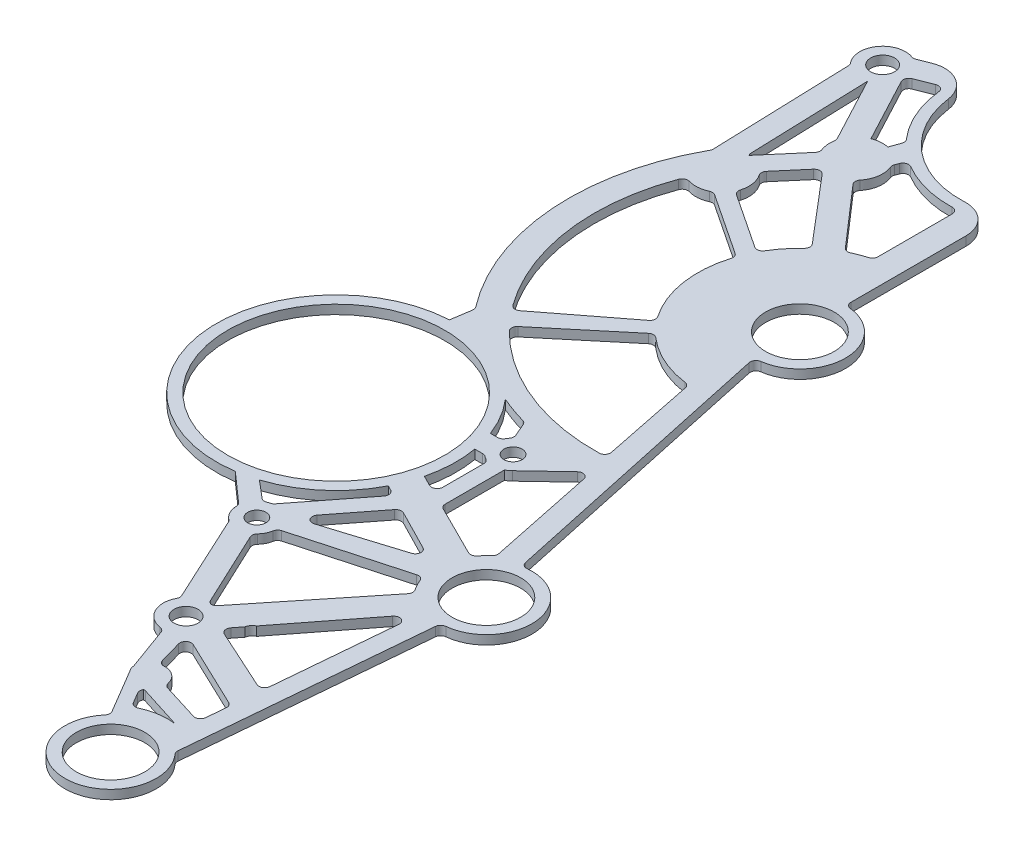
from build123d import *

# Parameters (mm, degrees)
SKETCH1_R           = 1.6
SKETCH1_R_2         = 2
SKETCH1_R_3         = 1.65
SKETCH1_R_4         = 6
BOSS_EXTRUDE2_DEPTH = 1.5875
BOSS_EXTRUDE3_START = -1.5875
BOSS_EXTRUDE3_DEPTH = 1.5875
SKETCH4_R           = 4.4
SKETCH4_R_2         = 2.1
CUT_EXTRUDE1_DEPTH  = 1.5875
BOSS_EXTRUDE4_START = -1.5875
BOSS_EXTRUDE4_DEPTH = 1.5875
SKETCH7_R           = 2.1
CUT_EXTRUDE2_DEPTH  = 1.5875
CUT_EXTRUDE3_DEPTH  = 1.5875
CUT_EXTRUDE4_DEPTH  = 1.5875
SKETCH10_R          = 4.645349595
BOSS_EXTRUDE5_DEPTH = 1.5875
CUT_EXTRUDE5_DEPTH  = 1.5875
CUT_EXTRUDE9_DEPTH  = 1.5875
SKETCH19_R          = 4
BOSS_EXTRUDE8_DEPTH = 1.5875
SKETCH20_R          = 2.1
CUT_EXTRUDE12_DEPTH = 1.5875
FILLET1_START       = -1
FILLET1_DEPTH       = 4
FILLET1_2_DEPTH     = 1.5875
SKETCH21_R          = 21
BOSS_EXTRUDE9_DEPTH = 1.5875
SKETCH22_R          = 19
SKETCH22_R_2        = 16.40193841
CUT_EXTRUDE13_DEPTH = 1.5875
FILLET2_R           = 5


with BuildPart() as part:
    # Sketch1 → Boss-Extrude2 (new body)
    with BuildSketch(Plane(origin=(0, 0, 0), x_dir=(1, 0, 0), z_dir=(0, 1, 0))):
        with BuildLine():
            Line((57.785577921, -3.804263015), (46.607089569, 48.169037391))
            ThreePointArc((46.607089569, 48.169037391), (54.607089569, 56.169037391), (46.607089569, 64.169037391))
            Line((46.607089569, 64.169037391), (46.607089569, 96.669037391))
            ThreePointArc((46.607089569, 96.669037391), (9.774896481, 73.010639225), (15.974342375, 29.675928865))
            Line((15.974342375, 29.675928865), (13.412399058, 22.705365919))
            ThreePointArc((13.412399058, 22.705365919), (-1.253243965, 6.307648563), (13.412399058, -10.090068793))
            Line((13.412399058, -10.090068793), (44.33382846, -62.316035804))
            ThreePointArc((44.33382846, -62.316035804), (50, -75.963557391), (55.66617154, -62.316035804))
            Line((55.66617154, -62.316035804), (59.462816555, -19.578912916))
            ThreePointArc((59.462816555, -19.578912916), (67.394599283, -10.759075533), (57.785577921, -3.804263015))
        make_face()
        with Locations(Location((27.233234802, -19.578912916, 0), (0, 0, 270))):
            Circle(SKETCH1_R, mode=Mode.SUBTRACT)
        with Locations(Location((44.33382846, -37.488387538, 0), (0, 0, 270))):
            Circle(SKETCH1_R, mode=Mode.SUBTRACT)
        with Locations(Location((40.089632361, 12.439739227, 0), (0, 0, 270))):
            Circle(SKETCH1_R, mode=Mode.SUBTRACT)
        with Locations(Location((12.005418324, 17.147101033, 0), (0, 0, 270))):
            Circle(SKETCH1_R_2, mode=Mode.SUBTRACT)
        with Locations(Location((26.086208505, 9.548986275, 0), (0, 0, 270))):
            Circle(SKETCH1_R_3, mode=Mode.SUBTRACT)
        with Locations(Location((4.407303566, 3.066310852, 0), (0, 0, 270))):
            Circle(SKETCH1_R_2, mode=Mode.SUBTRACT)
        with Locations(Location((18.488093747, -4.531803906, 0), (0, 0, 270))):
            Circle(SKETCH1_R_3, mode=Mode.SUBTRACT)
        with Locations(Location((46.607089569, 56.169037391, 0), (0, 0, 270))):
            Circle(SKETCH1_R_4, mode=Mode.SUBTRACT)
        with Locations(Location((59.462816555, -11.60242182, 0), (0, 0, 270))):
            Circle(SKETCH1_R_4, mode=Mode.SUBTRACT)
        with Locations(Location((50, -67.963557391, 0), (0, 0, 270))):
            Circle(SKETCH1_R_4, mode=Mode.SUBTRACT)
    extrude(amount=BOSS_EXTRUDE2_DEPTH)

    # Sketch3 → Boss-Extrude3 (add)
    with BuildSketch(Plane(origin=(0, 1.5875, 0), x_dir=(1, 0, 0), z_dir=(0, 1, 0)).offset(BOSS_EXTRUDE3_START)):
        with BuildLine():
            ThreePointArc((56.343437375, 106.672616503), (38.029280092, 122.267991205), (25.551142047, 101.702968958))
            ThreePointArc((25.551142047, 101.702968958), (27.87263843, 97.242332074), (31.478334129, 93.737252132))
            ThreePointArc((31.478334129, 93.737252132), (38.901984022, 95.929336038), (46.607089569, 96.669037391))
            Line((46.607089569, 96.669037391), (46.607089569, 92.08436081))
            ThreePointArc((46.607089569, 92.08436081), (53.685796044, 97.903157102), (56.343437375, 106.672616503))
        make_face()
        with BuildLine():
            ThreePointArc((46.607089569, 96.669037391), (38.901984022, 95.929336038), (31.478334129, 93.737252132))
            ThreePointArc((31.478334129, 93.737252132), (38.83054718, 90.968883646), (46.607089569, 92.08436081))
            Line((46.607089569, 92.08436081), (46.607089569, 96.669037391))
        make_face()
        with BuildLine():
            Line((25.551142047, 101.702968958), (23.684957519, 89.558045497))
            ThreePointArc((23.684957519, 89.558045497), (27.467237121, 91.860997946), (31.478334129, 93.737252132))
            ThreePointArc((31.478334129, 93.737252132), (27.87263843, 97.242332074), (25.551142047, 101.702968958))
        make_face()
        with BuildLine():
            Line((14.718034312, 31.202296417), (13.412399058, 22.705365919))
            Line((13.412399058, 22.705365919), (15.974342375, 29.675928865))
            ThreePointArc((15.974342375, 29.675928865), (15.33687379, 30.431446107), (14.718034312, 31.202296417))
        make_face()
    extrude(amount=BOSS_EXTRUDE3_DEPTH)

    # Sketch4 → Cut-Extrude1 (cut)
    with BuildSketch(Plane(origin=(0, 1.5875, 0), x_dir=(1, 0, 0), z_dir=(0, 1, 0))):
        with Locations(Location((40.546257627, 106.672616503, 0), (0, 0, 270))):
            Circle(SKETCH4_R)
        with Locations(Location((40.546257627, 117.14024961, 0), (0, 0, 270))):
            Circle(SKETCH4_R_2)
        with Locations(Location((30.07862452, 106.672616503, 0), (0, 0, 270))):
            Circle(SKETCH4_R_2)
        with Locations(Location((51.013890734, 106.672616503, 0), (0, 0, 270))):
            Circle(SKETCH4_R_2)
        with Locations(Location((40.546257627, 96.204983396, 0), (0, 0, 270))):
            Circle(SKETCH4_R_2)
    extrude(amount=-CUT_EXTRUDE1_DEPTH, mode=Mode.SUBTRACT)

    # Sketch5 → Boss-Extrude4 (add)
    with BuildSketch(Plane(origin=(0, 1.5875, 0), x_dir=(1, 0, 0), z_dir=(0, 1, 0)).offset(BOSS_EXTRUDE4_START)):
        with BuildLine():
            ThreePointArc((25.551142047, 101.702968958), (24.749079693, 106.66504565), (25.546385494, 111.627888844))
            Line((25.546385494, 111.627888844), (15.069905078, 107.519355049))
            ThreePointArc((15.069905078, 107.519355049), (16.746586116, 106.043341376), (17.370320575, 103.898386599))
            ThreePointArc((17.370320575, 103.898386599), (14.869777486, 100.190067711), (10.494506089, 101.118154407))
            Line((10.494506089, 101.118154407), (11.324057448, 76.05263979))
            ThreePointArc((11.324057448, 76.05263979), (16.731358953, 83.512971273), (23.684957519, 89.558045497))
            Line((23.684957519, 89.558045497), (25.551142047, 101.702968958))
        make_face()
        with BuildLine():
            ThreePointArc((17.370320575, 103.898386599), (16.746586116, 106.043341376), (15.069905078, 107.519355049))
            Line((15.069905078, 107.519355049), (10.494506089, 101.118154407))
            ThreePointArc((10.494506089, 101.118154407), (14.869777486, 100.190067711), (17.370320575, 103.898386599))
        make_face()
        with BuildLine():
            Line((10.494506089, 101.118154407), (15.069905078, 107.519355049))
            ThreePointArc((15.069905078, 107.519355049), (10.116135322, 106.224387102), (10.494506089, 101.118154407))
        make_face()
    extrude(amount=BOSS_EXTRUDE4_DEPTH)

    # Sketch7 → Cut-Extrude2 (cut)
    with BuildSketch(Plane(origin=(0, 1.5875, 0), x_dir=(1, 0, 0), z_dir=(0, 1, 0))):
        with Locations(Location((13.370320575, 103.898386599, 0), (0, 0, 270))):
            Circle(SKETCH7_R)
    extrude(amount=-CUT_EXTRUDE2_DEPTH, mode=Mode.SUBTRACT)

    # Sketch8 → Cut-Extrude3 (cut)
    with BuildSketch(Plane(origin=(0, 1.5875, 0), x_dir=(1, 0, 0), z_dir=(0, 1, 0))):
        with BuildLine():
            Line((22.270838211, 106.046731613), (17.003966644, 103.98123643))
            Line((17.003966644, 103.98123643), (25.133879781, 88.688315663))
            Line((25.133879781, 88.688315663), (27.134869461, 94.242115541))
            ThreePointArc((27.134869461, 94.242115541), (23.639138303, 99.70612507), (22.270838211, 106.046731613))
        make_face()
        with BuildLine():
            Line((23.303910604, 83.609187721), (14.529941424, 100.113621806))
            Line((14.529941424, 100.113621806), (15.247017929, 78.446619001))
            ThreePointArc((15.247017929, 78.446619001), (19.293244571, 76.357661165), (19.633932022, 71.816777227))
            Line((19.633932022, 71.816777227), (30.737973308, 64.447240272))
            ThreePointArc((30.737973308, 64.447240272), (32.619982891, 67.336773985), (35.021180558, 69.811771949))
            Line((35.021180558, 69.811771949), (23.303910604, 83.609187721))
        make_face()
        with BuildLine():
            ThreePointArc((17.853338423, 69.811771949), (15.561587714, 69.11846853), (13.227665034, 69.65288023))
            ThreePointArc((13.227665034, 69.65288023), (10.939961924, 51.284776385), (18.081503164, 34.207914463))
            Line((18.081503164, 34.207914463), (32.424696296, 45.250373787))
            ThreePointArc((32.424696296, 45.250373787), (28.946124471, 53.262526481), (29.673617088, 61.966882128))
            Line((29.673617088, 61.966882128), (17.853338423, 69.811771949))
        make_face()
    extrude(amount=-CUT_EXTRUDE3_DEPTH, mode=Mode.SUBTRACT)

    # Sketch9 → Cut-Extrude4 (cut)
    with BuildSketch(Plane(origin=(0, 1.5875, 0), x_dir=(1, 0, 0), z_dir=(0, 1, 0))):
        with BuildLine():
            ThreePointArc((42.074546437, 88.450459111), (35.884397618, 88.990711969), (30.232534907, 91.572622783))
            Line((30.232534907, 91.572622783), (29.429468095, 89.400967731))
            ThreePointArc((29.429468095, 89.400967731), (29.783097277, 88.406341356), (29.90303822, 87.357556633))
            ThreePointArc((29.90303822, 87.357556633), (29.485817932, 85.43344764), (28.309102029, 83.854964865))
            Line((28.309102029, 83.854964865), (38.418011185, 72.251364401))
            ThreePointArc((38.418011185, 72.251364401), (40.208614988, 73.043923164), (42.074546437, 73.637818103))
            Line((42.074546437, 73.637818103), (42.074546437, 88.450459111))
        make_face()
    extrude(amount=-CUT_EXTRUDE4_DEPTH, mode=Mode.SUBTRACT)

    # Sketch10 → Boss-Extrude5 (add)
    with BuildSketch(Plane(origin=(0, 1.5875, 0), x_dir=(1, 0, 0), z_dir=(0, 1, 0))):
        with BuildLine():
            Line((21.149022647, 85.190038065), (15.401380278, 78.449172638))
            Line((15.401380278, 78.449172638), (18.822645862, 76.956289361))
            Line((18.822645862, 76.956289361), (23.902708068, 82.914213235))
            ThreePointArc((23.902708068, 82.914213235), (22.29834697, 83.776834662), (21.149022647, 85.190038065))
        make_face()
        with Locations((25.257688625, 87.357556633)):
            Circle(SKETCH10_R)
    extrude(amount=-BOSS_EXTRUDE5_DEPTH)

    # Sketch11 → Cut-Extrude5 (cut)
    with BuildSketch(Plane(origin=(0, 1.5875, 0), x_dir=(1, 0, 0), z_dir=(0, 1, 0))):
        with BuildLine():
            ThreePointArc((44.938100904, 38.348488279), (39.181474054, 39.883530704), (34.247593759, 43.222981731))
            Line((34.247593759, 43.222981731), (20.307532747, 31.585845755))
            ThreePointArc((20.307532747, 31.585845755), (33.204031538, 22.757092889), (48.626702285, 20.225732528))
            Line((48.626702285, 20.225732528), (44.938100904, 38.348488279))
        make_face()
        with BuildLine():
            ThreePointArc((36.26030403, 18.303590576), (27.416947578, 21.925987237), (19.710998912, 27.57798388))
            Line((19.710998912, 27.57798388), (18.938710266, 22.389298788))
            ThreePointArc((18.938710266, 22.389298788), (25.46420767, 19.263484394), (30.024920763, 13.646302887))
            Line((30.024920763, 13.646302887), (36.804178947, 13.646302887))
            ThreePointArc((36.804178947, 13.646302887), (37.166998848, 14.365411409), (37.684600309, 14.982537063))
            Line((37.684600309, 14.982537063), (36.26030403, 18.303590576))
        make_face()
        with BuildLine():
            Line((23.748837452, -19.248799138), (13.412399058, -10.090068793))
            Line((13.412399058, -10.090068793), (32.107751545, -41.666321285))
            ThreePointArc((32.107751545, -41.666321285), (32.068874877, -40.005058031), (32.708438415, -38.471348322))
            Line((32.708438415, -38.471348322), (25.310969778, -22.503788499))
            ThreePointArc((25.310969778, -22.503788499), (24.077804809, -21.093264776), (23.748837452, -19.248799138))
        make_face()
        with BuildLine():
            Line((37.684600309, 9.896941391), (31.351630359, 9.896941391))
            ThreePointArc((31.351630359, 9.896941391), (31.742887661, 6.664917922), (31.491928413, 3.418985476))
            Line((31.491928413, 3.418985476), (38.929266279, -0.294255815))
            Line((38.929266279, -0.294255815), (38.929266279, 9.137686751))
            ThreePointArc((38.929266279, 9.137686751), (38.266960458, 9.451785557), (37.684600309, 9.896941391))
        make_face()
        with BuildLine():
            ThreePointArc((29.936377952, -1.206671629), (24.790621379, -7.152092679), (17.477492698, -10.040862499))
            Line((17.477492698, -10.040862499), (25.310969778, -16.654037333))
            ThreePointArc((25.310969778, -16.654037333), (25.917615868, -16.335589494), (26.574677388, -16.14142806))
            Line((26.574677388, -16.14142806), (35.856851812, -4.235227198))
            Line((35.856851812, -4.235227198), (29.936377952, -1.206671629))
        make_face()
        with BuildLine():
            ThreePointArc((36, -44.74414887), (34.564180779, -44.477568638), (33.319742068, -43.713360451))
            Line((33.319742068, -43.713360451), (38.988258823, -53.287425259))
            ThreePointArc((38.988258823, -53.287425259), (38.982277864, -53.110729221), (38.987264085, -52.934002315))
            Line((38.987264085, -52.934002315), (36, -44.74414887))
        make_face()
        with BuildLine():
            Line((49.652635334, 16.6671019), (42.494664412, 9.896941391))
            ThreePointArc((42.494664412, 9.896941391), (42.113801435, 9.58443897), (41.69283275, 9.328509806))
            Line((41.69283275, 9.328509806), (41.69283275, -1.674022247))
            Line((41.69283275, -1.674022247), (51.893737087, -6.76702997))
            ThreePointArc((51.893737087, -6.76702997), (52.859204313, -5.514377495), (54.029419034, -4.450487136))
            Line((54.029419034, -4.450487136), (49.652635334, 16.6671019))
        make_face()
        with BuildLine():
            ThreePointArc((30.733234802, -19.578912916), (30.347372441, -21.176456895), (29.274865223, -22.421753964))
            Line((29.274865223, -22.421753964), (36, -36.74414887))
            ThreePointArc((36, -36.74414887), (36.404157783, -36.764619188), (36.804178947, -36.825820626))
            Line((36.804178947, -36.825820626), (52.50945718, -17.287733752))
            ThreePointArc((52.50945718, -17.287733752), (51.488220715, -15.734951255), (50.808425135, -14.005230072))
            Line((50.808425135, -14.005230072), (30.733234802, -19.578912916))
        make_face()
        with BuildLine():
            Line((53.46362734, -50.406848658), (38.929266279, -43.468006257))
            Line((38.929266279, -43.468006257), (40.907560182, -50.406848658))
            ThreePointArc((40.907560182, -50.406848658), (43.470698918, -50.770628666), (44.682047755, -53.058564433))
            Line((44.682047755, -53.058564433), (52.998564734, -55.641373157))
            Line((52.998564734, -55.641373157), (53.46362734, -50.406848658))
        make_face()
        Polygon((48.53670869, -10.721473414), (38.603269126, -5.640127828), (30.179720323, -16.453526736), align=None)
        with BuildLine():
            ThreePointArc((43.380170812, -55.495829677), (43.141144188, -55.634475907), (42.889814418, -55.749322982))
            Line((42.889814418, -55.749322982), (44.97511935, -59.271380942))
            ThreePointArc((44.97511935, -59.271380942), (48.033331446, -58.11797098), (51.299968657, -58.007984155))
            Line((51.299968657, -58.007984155), (43.380170812, -55.495829677))
        make_face()
        Polygon((53.899807967, -45.497406051), (56.16883109, -19.958356125), (40.907560182, -39.577437576), align=None)
    extrude(amount=-CUT_EXTRUDE5_DEPTH, mode=Mode.SUBTRACT)

    # Sketch13 → Cut-Extrude9 (cut)
    with BuildSketch(Plane(origin=(0, 1.5875, 0), x_dir=(1, 0, 0), z_dir=(0, 1, 0))):
        with BuildLine():
            ThreePointArc((32.281400747, -39.270371546), (32.010464376, -40.455002704), (32.107751545, -41.666321285))
            Line((32.107751545, -41.666321285), (33.319742068, -43.713360451))
            ThreePointArc((33.319742068, -43.713360451), (33.86679158, -44.127848301), (34.476645862, -44.442715101))
            Line((34.476645862, -44.442715101), (32.281400747, -39.270371546))
        make_face()
    extrude(amount=-CUT_EXTRUDE9_DEPTH, mode=Mode.SUBTRACT)

    # Sketch19 → Boss-Extrude8 (add)
    with BuildSketch(Plane(origin=(0, 1.5875, 0), x_dir=(1, 0, 0), z_dir=(0, 1, 0))):
        with Locations((36, -40.74414887)):
            Circle(SKETCH19_R)
    extrude(amount=-BOSS_EXTRUDE8_DEPTH)

    # Sketch20 → Cut-Extrude12 (cut)
    with BuildSketch(Plane(origin=(0, 1.5875, 0), x_dir=(1, 0, 0), z_dir=(0, 1, 0))):
        with Locations(Location((36, -40.74414887, 0), (0, 0, 270))):
            Circle(SKETCH20_R)
    extrude(amount=-CUT_EXTRUDE12_DEPTH, mode=Mode.SUBTRACT)

    # Fillet1: read off the stored shape, not the designer's step
    # Fillet1 outline → Fillet1 (cut)
    with BuildSketch(Plane(origin=(0, 0, 0), x_dir=(1, 0, 0), z_dir=(0, 1, 0)).offset(FILLET1_START)):
        with BuildLine():
            Line((38.988258823, -53.287425259), (39.124224156, -53.517069268))
            ThreePointArc((39.124224156, -53.517069268), (39.013748973, -53.246825905), (38.9860351, -52.9561918))
            ThreePointArc((38.9860351, -52.9561918), (38.9823308, -53.121840863), (38.988258823, -53.287425259))
        make_face()
    extrude(amount=FILLET1_DEPTH, mode=Mode.SUBTRACT)

    # Fillet1 2 outline → Fillet1 2 (add)
    with BuildSketch(Plane(origin=(0, 0, 0), x_dir=(1, 0, 0), z_dir=(0, 1, 0))):
        with BuildLine():
            ThreePointArc((15.444488116, 107.666254295), (15.091836344, 107.5973016), (14.7375778, 107.657456654))
            ThreePointArc((14.7375778, 107.657456654), (14.90529535, 107.592145178), (15.069905078, 107.519355049))
            Line((15.069905078, 107.519355049), (15.444488116, 107.666254295))
        make_face()
        with BuildLine():
            ThreePointArc((10.494506089, 101.118154407), (10.384649941, 101.236475469), (10.279658242, 101.359133491))
            ThreePointArc((10.279658242, 101.359133491), (10.442739667, 101.076992212), (10.506445458, 100.75739743))
            Line((10.506445458, 100.75739743), (10.494506089, 101.118154407))
        make_face()
        with BuildLine():
            ThreePointArc((25.692555244, 112.050200859), (25.468650898, 111.69289574), (25.117375671, 111.459645189))
            Line((25.117375671, 111.459645189), (25.546385494, 111.627888844))
            ThreePointArc((25.546385494, 111.627888844), (25.617976926, 111.839561759), (25.692555244, 112.050200859))
        make_face()
        with BuildLine():
            Line((11.324057448, 76.05263979), (11.314852259, 76.330781454))
            ThreePointArc((11.314852259, 76.330781454), (11.287526872, 76.063251056), (11.189898017, 75.812676122))
            ThreePointArc((11.189898017, 75.812676122), (11.256774118, 75.932771793), (11.324057448, 76.05263979))
        make_face()
        with BuildLine():
            ThreePointArc((46.607089569, 91.431556836), (46.764368327, 91.969907009), (47.186731387, 92.338915089))
            ThreePointArc((47.186731387, 92.338915089), (46.898185768, 92.208734006), (46.607089569, 92.08436081))
            Line((46.607089569, 92.08436081), (46.607089569, 91.431556836))
        make_face()
        with BuildLine():
            ThreePointArc((14.718034312, 31.202296417), (14.587675646, 31.36970006), (14.458195766, 31.537784332))
            ThreePointArc((14.458195766, 31.537784332), (14.63314763, 31.177637749), (14.652795307, 30.777728153))
            Line((14.652795307, 30.777728153), (14.718034312, 31.202296417))
        make_face()
        with BuildLine():
            ThreePointArc((47.495978458, 64.119501311), (46.861733576, 64.446642634), (46.607089569, 65.113309301))
            Line((46.607089569, 65.113309301), (46.607089569, 64.169037391))
            ThreePointArc((46.607089569, 64.169037391), (47.052223616, 64.156643771), (47.495978458, 64.119501311))
        make_face()
        with BuildLine():
            Line((13.412399058, 22.705365919), (13.526020591, 23.444802343))
            ThreePointArc((13.526020591, 23.444802343), (13.245775736, 22.89062196), (12.692428908, 22.608734813))
            ThreePointArc((12.692428908, 22.608734813), (13.051882136, 22.661013005), (13.412399058, 22.705365919))
        make_face()
        with BuildLine():
            ThreePointArc((46.849527021, 47.041847905), (47.008370288, 47.826200241), (47.691605317, 48.242889172))
            ThreePointArc((47.691605317, 48.242889172), (47.150603252, 48.187521691), (46.607089569, 48.169037391))
            Line((46.607089569, 48.169037391), (46.849527021, 47.041847905))
        make_face()
        with BuildLine():
            ThreePointArc((13.412399058, -10.090068793), (13.262072415, -10.072553845), (13.111912747, -10.053660802))
            ThreePointArc((13.111912747, -10.053660802), (13.397038675, -10.13521072), (13.645709583, -10.296796497))
            Line((13.645709583, -10.296796497), (13.412399058, -10.090068793))
        make_face()
        with BuildLine():
            ThreePointArc((58.664749342, -3.66595542), (57.976068497, -3.479376972), (57.587054161, -2.881245992))
            Line((57.587054161, -2.881245992), (57.785577921, -3.804263015))
            ThreePointArc((57.785577921, -3.804263015), (58.223233155, -3.722837873), (58.664749342, -3.66595542))
        make_face()
        with BuildLine():
            Line((23.748837452, -19.248799138), (23.397693357, -18.937663527))
            ThreePointArc((23.397693357, -18.937663527), (23.64147446, -19.264910706), (23.73422824, -19.662298022))
            ThreePointArc((23.73422824, -19.662298022), (23.735417214, -19.45533251), (23.748837452, -19.248799138))
        make_face()
        with BuildLine():
            ThreePointArc((59.386033328, -20.443227125), (59.670076057, -19.829571274), (60.279699229, -19.53697366))
            ThreePointArc((60.279699229, -19.53697366), (59.871795835, -19.568421202), (59.462816555, -19.578912916))
            Line((59.462816555, -19.578912916), (59.386033328, -20.443227125))
        make_face()
        with BuildLine():
            ThreePointArc((25.310969778, -22.503788499), (25.214039112, -22.437732386), (25.119376368, -22.368465303))
            ThreePointArc((25.119376368, -22.368465303), (25.294189119, -22.538173568), (25.42277364, -22.745119005))
            Line((25.42277364, -22.745119005), (25.310969778, -22.503788499))
        make_face()
        with BuildLine():
            ThreePointArc((55.957364504, -62.624099726), (55.753138458, -62.272254629), (55.705957884, -61.86817884))
            Line((55.705957884, -61.86817884), (55.66617154, -62.316035804))
            ThreePointArc((55.66617154, -62.316035804), (55.813808854, -62.468138698), (55.957364504, -62.624099726))
        make_face()
        with BuildLine():
            Line((32.708438415, -38.471348322), (32.485434781, -37.989991246))
            ThreePointArc((32.485434781, -37.989991246), (32.577742837, -38.436239317), (32.462462365, -38.877111783))
            ThreePointArc((32.462462365, -38.877111783), (32.579428405, -38.670579492), (32.708438415, -38.471348322))
        make_face()
        with BuildLine():
            ThreePointArc((43.957094166, -61.679735568), (44.093326483, -62.27012019), (43.863649318, -62.830799818))
            ThreePointArc((43.863649318, -62.830799818), (44.09312873, -62.568293561), (44.33382846, -62.316035804))
            Line((44.33382846, -62.316035804), (43.957094166, -61.679735568))
        make_face()
        with BuildLine():
            ThreePointArc((36, -44.74414887), (35.711799539, -44.733752922), (35.425097136, -44.702619117))
            ThreePointArc((35.425097136, -44.702619117), (35.912209485, -44.916322163), (36.220827824, -45.34956823))
            Line((36.220827824, -45.34956823), (36, -44.74414887))
        make_face()
        with BuildLine():
            ThreePointArc((43.396527569, -55.58304418), (43.595224077, -55.584755398), (43.789659652, -55.625719258))
            Line((43.789659652, -55.625719258), (43.380170812, -55.495829677))
            ThreePointArc((43.380170812, -55.495829677), (43.141144188, -55.634475907), (42.889814418, -55.749322982))
            Line((42.889814418, -55.749322982), (43.395587309, -56.603568042))
            ThreePointArc((43.395587309, -56.603568042), (43.256076417, -56.093177139), (43.396527569, -55.58304418))
        make_face()
        with BuildLine():
            ThreePointArc((44.97511935, -59.271380942), (45.370345823, -59.05459229), (45.77490484, -58.855762495))
            ThreePointArc((45.77490484, -58.855762495), (45.057666006, -58.903678352), (44.493593613, -58.458089068))
            Line((44.493593613, -58.458089068), (44.97511935, -59.271380942))
        make_face()
        with BuildLine():
            ThreePointArc((39.536976189, -45.599541558), (39.853245067, -44.561526362), (40.929485064, -44.422929756))
            Line((40.929485064, -44.422929756), (38.929266279, -43.468006257))
            Line((38.929266279, -43.468006257), (39.536976189, -45.599541558))
        make_face()
        with BuildLine():
            Line((53.46362734, -50.406848658), (52.836923599, -50.107654323))
            ThreePointArc((52.836923599, -50.107654323), (53.274713658, -50.514608843), (53.402169943, -51.098584024))
            Line((53.402169943, -51.098584024), (53.46362734, -50.406848658))
        make_face()
        with BuildLine():
            ThreePointArc((41.675157171, -50.256983006), (41.039836018, -50.07299683), (40.658331922, -49.532683491))
            Line((40.658331922, -49.532683491), (40.907560182, -50.406848658))
            ThreePointArc((40.907560182, -50.406848658), (41.286193643, -50.305461041), (41.675157171, -50.256983006))
        make_face()
        with BuildLine():
            Line((52.998564734, -55.641373157), (53.10819241, -54.407455939))
            ThreePointArc((53.10819241, -54.407455939), (52.668918872, -55.149603906), (51.81552602, -55.273964215))
            Line((51.81552602, -55.273964215), (52.998564734, -55.641373157))
        make_face()
        with BuildLine():
            ThreePointArc((45.300238966, -53.250552215), (44.85866114, -52.970164496), (44.619052098, -52.505195942))
            ThreePointArc((44.619052098, -52.505195942), (44.664099354, -52.780337716), (44.682047755, -53.058564433))
            Line((44.682047755, -53.058564433), (45.300238966, -53.250552215))
        make_face()
        with BuildLine():
            ThreePointArc((54.082769495, -22.640086408), (55.238224697, -22.323517676), (55.868159476, -23.342573445))
            Line((55.868159476, -23.342573445), (56.16883109, -19.958356125))
            Line((56.16883109, -19.958356125), (54.082769495, -22.640086408))
        make_face()
        with BuildLine():
            Line((40.907560182, -39.577437576), (42.059430997, -40.102292014))
            ThreePointArc((42.059430997, -40.102292014), (41.502987168, -39.431049836), (41.684756218, -38.578315522))
            Line((41.684756218, -38.578315522), (40.907560182, -39.577437576))
        make_face()
        with BuildLine():
            Line((53.899807967, -45.497406051), (54.024841251, -44.090090606))
            ThreePointArc((54.024841251, -44.090090606), (53.531983114, -44.865753254), (52.614126049, -44.911580061))
            Line((52.614126049, -44.911580061), (53.899807967, -45.497406051))
        make_face()
        with BuildLine():
            ThreePointArc((30.680385801, -20.184841946), (30.92479003, -19.685903822), (31.397765159, -19.394412476))
            Line((31.397765159, -19.394412476), (30.733234802, -19.578912916))
            ThreePointArc((30.733234802, -19.578912916), (30.71999752, -19.883027617), (30.680385801, -20.184841946))
        make_face()
        with BuildLine():
            Line((50.808425135, -14.005230072), (49.89326045, -14.259316714))
            ThreePointArc((49.89326045, -14.259316714), (50.608670804, -14.328779808), (51.092684865, -14.860162424))
            ThreePointArc((51.092684865, -14.860162424), (50.939828575, -14.436262718), (50.808425135, -14.005230072))
        make_face()
        with BuildLine():
            ThreePointArc((29.593458015, -23.100255131), (29.511396297, -22.515990701), (29.772992179, -21.987155525))
            ThreePointArc((29.772992179, -21.987155525), (29.53421231, -22.216241585), (29.274865223, -22.421753964))
            Line((29.274865223, -22.421753964), (29.593458015, -23.100255131))
        make_face()
        with BuildLine():
            ThreePointArc((52.50945718, -17.287733752), (52.282209789, -16.997870349), (52.067037678, -16.698933682))
            ThreePointArc((52.067037678, -16.698933682), (52.242936776, -17.303199982), (52.023026445, -17.892875911))
            Line((52.023026445, -17.892875911), (52.50945718, -17.287733752))
        make_face()
        with BuildLine():
            ThreePointArc((36.414776344, -36.757901365), (36.020903156, -36.560173528), (35.750281599, -36.212328218))
            Line((35.750281599, -36.212328218), (36, -36.74414887))
            ThreePointArc((36, -36.74414887), (36.404157783, -36.764619188), (36.804178947, -36.825820626))
            Line((36.804178947, -36.825820626), (37.158481456, -36.385052045))
            ThreePointArc((37.158481456, -36.385052045), (36.827242346, -36.652486448), (36.414776344, -36.757901365))
        make_face()
        with BuildLine():
            ThreePointArc((46.356924582, -9.606427987), (46.897893471, -10.581693068), (46.199572782, -11.451254758))
            Line((46.199572782, -11.451254758), (48.53670869, -10.721473414))
            Line((48.53670869, -10.721473414), (46.356924582, -9.606427987))
        make_face()
        with BuildLine():
            Line((30.179720323, -16.453526736), (33.231234935, -15.500677384))
            ThreePointArc((33.231234935, -15.500677384), (32.111143203, -15.115574645), (32.144285517, -13.931593567))
            Line((32.144285517, -13.931593567), (30.179720323, -16.453526736))
        make_face()
        with BuildLine():
            ThreePointArc((38.095121492, -6.292442333), (38.667653502, -5.930664926), (39.339422709, -6.01669938))
            Line((39.339422709, -6.01669938), (38.603269126, -5.640127828))
            Line((38.603269126, -5.640127828), (38.095121492, -6.292442333))
        make_face()
        with BuildLine():
            ThreePointArc((26.789581852, -15.86577113), (26.559782265, -16.080198457), (26.27477536, -16.212705035))
            ThreePointArc((26.27477536, -16.212705035), (26.423941295, -16.173763283), (26.574677388, -16.14142806))
            Line((26.574677388, -16.14142806), (26.789581852, -15.86577113))
        make_face()
        with BuildLine():
            ThreePointArc((25.310969778, -16.654037333), (25.567850855, -16.500521078), (25.836906925, -16.369509785))
            ThreePointArc((25.836906925, -16.369509785), (25.293089517, -16.441988659), (24.792875584, -16.216652063))
            Line((24.792875584, -16.216652063), (25.310969778, -16.654037333))
        make_face()
        with BuildLine():
            ThreePointArc((34.779755447, -3.684249984), (35.300698157, -4.358361524), (35.112994149, -5.189369875))
            Line((35.112994149, -5.189369875), (35.856851812, -4.235227198))
            Line((35.856851812, -4.235227198), (34.779755447, -3.684249984))
        make_face()
        with BuildLine():
            Line((17.477492698, -10.040862499), (19.061976017, -11.378514362))
            ThreePointArc((19.061976017, -11.378514362), (18.731532688, -10.394506096), (19.452182221, -9.64742557))
            ThreePointArc((19.452182221, -9.64742557), (18.470844466, -9.87429365), (17.477492698, -10.040862499))
        make_face()
        with BuildLine():
            ThreePointArc((29.482985561, -2.033800286), (30.065613971, -1.579393227), (30.801200695, -1.649062525))
            Line((30.801200695, -1.649062525), (29.936377952, -1.206671629))
            ThreePointArc((29.936377952, -1.206671629), (29.715593441, -1.62347646), (29.482985561, -2.033800286))
        make_face()
        with BuildLine():
            ThreePointArc((32.145558455, 3.092647463), (31.708684846, 3.519026725), (31.601078569, 4.119924981))
            ThreePointArc((31.601078569, 4.119924981), (31.550270876, 3.768868572), (31.491928413, 3.418985476))
            Line((31.491928413, 3.418985476), (32.145558455, 3.092647463))
        make_face()
        with BuildLine():
            ThreePointArc((31.351630359, 9.896941391), (31.468546625, 9.324850918), (31.565147256, 8.748981801))
            ThreePointArc((31.565147256, 8.748981801), (31.796526121, 9.549643624), (32.554140663, 9.896941391))
            Line((32.554140663, 9.896941391), (31.351630359, 9.896941391))
        make_face()
        with BuildLine():
            ThreePointArc((38.929266279, 1.322722212), (38.455245757, 0.472224953), (37.482575102, 0.428034003))
            Line((37.482575102, 0.428034003), (38.929266279, -0.294255815))
            Line((38.929266279, -0.294255815), (38.929266279, 1.322722212))
        make_face()
        with BuildLine():
            Line((37.68460031, 9.896941391), (37.315000224, 9.896941391))
            ThreePointArc((37.315000224, 9.896941391), (37.641122588, 9.842268956), (37.931585143, 9.684229799))
            ThreePointArc((37.931585143, 9.684229799), (37.805615142, 9.787708808), (37.68460031, 9.896941391))
        make_face()
        with BuildLine():
            ThreePointArc((38.409347631, 9.369455327), (38.789522448, 9.00209342), (38.929266279, 8.492231356))
            Line((38.929266279, 8.492231356), (38.929266279, 9.137686751))
            ThreePointArc((38.929266279, 9.137686751), (38.6645873, 9.242983595), (38.409347631, 9.369455327))
        make_face()
        with BuildLine():
            ThreePointArc((19.785297849, 22.17118027), (19.219645118, 22.59112991), (19.071257088, 23.279825565))
            Line((19.071257088, 23.279825565), (18.938710266, 22.389298788))
            ThreePointArc((18.938710266, 22.389298788), (19.363448908, 22.285847454), (19.785297849, 22.17118027))
        make_face()
        with BuildLine():
            Line((19.710998912, 27.57798388), (19.437374629, 25.739616525))
            ThreePointArc((19.437374629, 25.739616525), (20.076572852, 26.52918233), (21.076869721, 26.351996826))
            ThreePointArc((21.076869721, 26.351996826), (20.386767882, 26.957006237), (19.710998912, 27.57798388))
        make_face()
        with BuildLine():
            ThreePointArc((30.632361128, 13.646302887), (30.120743367, 13.78708972), (29.753183694, 14.169808354))
            ThreePointArc((29.753183694, 14.169808354), (29.891391651, 13.909269949), (30.024920763, 13.646302887))
            Line((30.024920763, 13.646302887), (30.632361128, 13.646302887))
        make_face()
        with BuildLine():
            ThreePointArc((36.26030403, 18.303590576), (36.032512757, 18.366572409), (35.805104812, 18.430924577))
            ThreePointArc((35.805104812, 18.430924577), (36.190970587, 18.219874871), (36.448966554, 17.863683271))
            Line((36.448966554, 17.863683271), (36.26030403, 18.303590576))
        make_face()
        with BuildLine():
            ThreePointArc((37.039287786, 14.155955407), (36.672563954, 13.783068423), (36.167760765, 13.646302887))
            Line((36.167760765, 13.646302887), (36.804178947, 13.646302887))
            ThreePointArc((36.804178947, 13.646302887), (36.911500762, 13.905849571), (37.039287786, 14.155955407))
        make_face()
        with BuildLine():
            Line((37.684600309, 14.982537063), (37.433873579, 15.567160432))
            ThreePointArc((37.433873579, 15.567160432), (37.507172094, 15.049510139), (37.309228607, 14.565616686))
            ThreePointArc((37.309228607, 14.565616686), (37.488547631, 14.781609896), (37.684600309, 14.982537063))
        make_face()
        with BuildLine():
            ThreePointArc((44.235588643, 38.42830806), (44.785787949, 38.167826934), (45.083000716, 37.636569686))
            Line((45.083000716, 37.636569686), (44.938100904, 38.348488279))
            ThreePointArc((44.938100904, 38.348488279), (44.586450602, 38.38492898), (44.235588643, 38.42830806))
        make_face()
        with BuildLine():
            Line((48.626702285, 20.225732528), (48.392228006, 21.377746434))
            ThreePointArc((48.392228006, 21.377746434), (48.193963598, 20.554577329), (47.435325547, 20.17856608))
            ThreePointArc((47.435325547, 20.17856608), (48.031209197, 20.197216708), (48.626702285, 20.225732528))
        make_face()
        with BuildLine():
            ThreePointArc((33.578492088, 42.66441695), (34.228952543, 42.896702751), (34.874827208, 42.651955098))
            ThreePointArc((34.874827208, 42.651955098), (34.557827318, 42.93375224), (34.247593759, 43.222981731))
            Line((34.247593759, 43.222981731), (33.578492088, 42.66441695))
        make_face()
        with BuildLine():
            ThreePointArc((20.307532747, 31.585845755), (20.682354893, 31.190884297), (21.063107846, 30.801637096))
            ThreePointArc((21.063107846, 30.801637096), (20.77374998, 31.55290244), (21.131815136, 32.273955099))
            Line((21.131815136, 32.273955099), (20.307532747, 31.585845755))
        make_face()
        with BuildLine():
            ThreePointArc((12.857010394, 68.696293901), (13.347039702, 69.24261205), (14.078074438, 69.307268505))
            ThreePointArc((14.078074438, 69.307268505), (13.644351257, 69.459113866), (13.227665034, 69.65288023))
            ThreePointArc((13.227665034, 69.65288023), (13.038930081, 69.175907443), (12.857010394, 68.696293901))
        make_face()
        with BuildLine():
            ThreePointArc((17.853338423, 69.811771949), (17.618262046, 69.675891896), (17.375681056, 69.553913393))
            ThreePointArc((17.375681056, 69.553913393), (17.873227886, 69.645033149), (18.351716569, 69.481008035))
            Line((18.351716569, 69.481008035), (17.853338423, 69.811771949))
        make_face()
        with BuildLine():
            ThreePointArc((18.885202552, 34.826662166), (18.132078368, 34.629330318), (17.465687982, 35.031896771))
            ThreePointArc((17.465687982, 35.031896771), (17.770652329, 34.61770594), (18.081503164, 34.207914463))
            Line((18.081503164, 34.207914463), (18.885202552, 34.826662166))
        make_face()
        with BuildLine():
            Line((29.673617088, 61.966882128), (29.044201346, 62.384613156))
            ThreePointArc((29.044201346, 62.384613156), (29.431270864, 61.892463788), (29.449810532, 61.266612294))
            ThreePointArc((29.449810532, 61.266612294), (29.558118068, 61.617896412), (29.673617088, 61.966882128))
        make_face()
        with BuildLine():
            ThreePointArc((31.866813009, 46.016119546), (32.031159121, 45.293732452), (31.653297583, 44.656493551))
            Line((31.653297583, 44.656493551), (32.424696296, 45.250373787))
            ThreePointArc((32.424696296, 45.250373787), (32.140687141, 45.629554736), (31.866813009, 46.016119546))
        make_face()
        with BuildLine():
            ThreePointArc((20.293280733, 71.379180269), (19.907593411, 71.867543634), (19.885406953, 72.48944495))
            ThreePointArc((19.885406953, 72.48944495), (19.772627845, 72.148266643), (19.633932022, 71.816777227))
            Line((19.633932022, 71.816777227), (20.293280733, 71.379180269))
        make_face()
        with BuildLine():
            ThreePointArc((18.822645862, 76.956289361), (19.0640644, 76.674345954), (19.282311925, 76.374107695))
            ThreePointArc((19.282311925, 76.374107695), (19.115647309, 76.988048963), (19.352988391, 77.57827789))
            Line((19.352988391, 77.57827789), (18.822645862, 76.956289361))
        make_face()
        with BuildLine():
            ThreePointArc((31.250428549, 65.363081994), (30.613308074, 64.901453211), (29.839467655, 65.043561056))
            Line((29.839467655, 65.043561056), (30.737973308, 64.447240272))
            ThreePointArc((30.737973308, 64.447240272), (30.987487038, 64.908917861), (31.250428549, 65.363081994))
        make_face()
        with BuildLine():
            Line((23.898399567, 82.909160203), (23.135928278, 82.014929835))
            ThreePointArc((23.135928278, 82.014929835), (23.897860977, 82.366108165), (24.659095593, 82.013419183))
            Line((24.659095593, 82.013419183), (23.898399567, 82.909160203))
        make_face()
        with BuildLine():
            ThreePointArc((34.391007982, 70.553817927), (34.627276162, 69.851656902), (34.315517839, 69.179600724))
            ThreePointArc((34.315517839, 69.179600724), (34.664165649, 69.500356234), (35.021180558, 69.811771949))
            Line((35.021180558, 69.811771949), (34.391007982, 70.553817927))
        make_face()
        with BuildLine():
            ThreePointArc((29.577638608, 89.065568636), (29.507652392, 89.422093053), (29.569665688, 89.780090374))
            Line((29.569665688, 89.780090374), (29.429468095, 89.400967731))
            ThreePointArc((29.429468095, 89.400967731), (29.506863888, 89.234730692), (29.577638608, 89.065568636))
        make_face()
        with BuildLine():
            Line((30.232534907, 91.572622783), (29.803255648, 90.411764861))
            ThreePointArc((29.803255648, 90.411764861), (30.40615171, 91.007133278), (31.249580472, 90.926046064))
            ThreePointArc((31.249580472, 90.926046064), (30.735729549, 91.24095342), (30.232534907, 91.572622783))
        make_face()
        with BuildLine():
            ThreePointArc((28.907334816, 83.168278088), (28.661540596, 83.8048477), (28.881286045, 84.450872164))
            ThreePointArc((28.881286045, 84.450872164), (28.608467452, 84.140173519), (28.309102029, 83.854964865))
            Line((28.309102029, 83.854964865), (28.907334816, 83.168278088))
        make_face()
        with BuildLine():
            ThreePointArc((42.074546437, 88.450459111), (41.561252176, 88.414673772), (41.04715428, 88.393344383))
            ThreePointArc((41.04715428, 88.393344383), (41.771901383, 88.110445562), (42.074546437, 87.393719618))
            Line((42.074546437, 87.393719618), (42.074546437, 88.450459111))
        make_face()
        with BuildLine():
            ThreePointArc((39.087134103, 72.57490575), (38.45987151, 72.506381466), (37.916452351, 72.827083129))
            Line((37.916452351, 72.827083129), (38.418011185, 72.251364401))
            ThreePointArc((38.418011185, 72.251364401), (38.750906916, 72.416580004), (39.087134103, 72.57490575))
        make_face()
        with BuildLine():
            Line((42.074546437, 73.637818103), (42.074546437, 74.395053376))
            ThreePointArc((42.074546437, 74.395053376), (41.877809955, 73.799429568), (41.365010996, 73.438167625))
            ThreePointArc((41.365010996, 73.438167625), (41.718759338, 73.541615621), (42.074546437, 73.637818103))
        make_face()
        with BuildLine():
            ThreePointArc((20.913428328, 85.712358976), (20.963486392, 85.187036592), (20.739184452, 84.709377658))
            Line((20.739184452, 84.709377658), (21.149022647, 85.190038065))
            ThreePointArc((21.149022647, 85.190038065), (21.023164397, 85.447562543), (20.913428328, 85.712358976))
        make_face()
        with BuildLine():
            ThreePointArc((15.247017929, 78.446619001), (15.324188543, 78.448534185), (15.401380278, 78.449172638))
            ThreePointArc((15.401380278, 78.449172638), (15.277980398, 78.701171208), (15.229447188, 78.97753209))
            Line((15.229447188, 78.97753209), (15.247017929, 78.446619001))
        make_face()
        with BuildLine():
            ThreePointArc((20.571221066, 88.74956301), (20.675108178, 88.441674177), (20.67479359, 88.116731156))
            ThreePointArc((20.67479359, 88.116731156), (20.704048702, 88.2760534), (20.738840838, 88.434258792))
            Line((20.738840838, 88.434258792), (20.571221066, 88.74956301))
        make_face()
        with BuildLine():
            ThreePointArc((52.362820873, -6.101327414), (51.794727886, -6.463809334), (51.125639059, -6.383541501))
            Line((51.125639059, -6.383541501), (51.893737087, -6.76702997))
            ThreePointArc((51.893737087, -6.76702997), (52.120730243, -6.428859515), (52.362820873, -6.101327414))
        make_face()
        with BuildLine():
            Line((41.69283275, -1.674022247), (42.246141573, -1.950272863))
            ThreePointArc((42.246141573, -1.950272863), (41.84233549, -1.581564132), (41.69283275, -1.055584653))
            Line((41.69283275, -1.055584653), (41.69283275, -1.674022247))
        make_face()
        with BuildLine():
            ThreePointArc((53.906034976, -3.855170115), (53.874091612, -4.378619846), (53.581636427, -4.813924295))
            ThreePointArc((53.581636427, -4.813924295), (53.802609979, -4.62861082), (54.029419034, -4.450487136))
            Line((54.029419034, -4.450487136), (53.906034976, -3.855170115))
        make_face()
        with BuildLine():
            ThreePointArc((48.350134464, 15.43516899), (49.337040843, 15.662671738), (50.01647667, 14.911600065))
            Line((50.01647667, 14.911600065), (49.652635334, 16.6671019))
            Line((49.652635334, 16.6671019), (48.350134464, 15.43516899))
        make_face()
        with BuildLine():
            ThreePointArc((26.746213418, 94.675055646), (26.974492942, 94.202815738), (26.93234064, 93.679991432))
            Line((26.93234064, 93.679991432), (27.134869461, 94.242115541))
            ThreePointArc((27.134869461, 94.242115541), (26.938819504, 94.45703979), (26.746213418, 94.675055646))
        make_face()
        with BuildLine():
            ThreePointArc((21.004653664, 105.550175346), (21.888333373, 105.474232341), (22.364065497, 104.725676322))
            ThreePointArc((22.364065497, 104.725676322), (22.305488546, 105.385359713), (22.270838211, 106.046731613))
            Line((22.270838211, 106.046731613), (21.004653664, 105.550175346))
        make_face()
        with BuildLine():
            Line((17.003966644, 103.98123643), (17.530650559, 102.990508087))
            ThreePointArc((17.530650559, 102.990508087), (17.475716785, 103.806773702), (18.048537492, 104.390883035))
            Line((18.048537492, 104.390883035), (17.003966644, 103.98123643))
        make_face()
    extrude(amount=FILLET1_2_DEPTH)

    # Sketch21 → Boss-Extrude9 (add)
    with BuildSketch(Plane(origin=(0, 1.5875, 0), x_dir=(1, 0, 0), z_dir=(0, 1, 0))):
        with Locations((15.246756035, 6.307648563)):
            Circle(SKETCH21_R)
    extrude(amount=-BOSS_EXTRUDE9_DEPTH)

    # Sketch22 → Cut-Extrude13 (cut)
    with BuildSketch(Plane(origin=(0, 1.5875, 0), x_dir=(1, 0, 0), z_dir=(0, 1, 0))):
        with Locations(Location((15.246756035, 6.307648563, 0), (0, 0, 270))):
            Circle(SKETCH22_R)
        with Locations((40.546257627, 106.672616503)):
            Circle(SKETCH22_R_2)
    extrude(amount=-CUT_EXTRUDE13_DEPTH, mode=Mode.SUBTRACT)

    # Fillet2
    fillet2_edges = [part.edges().sort_by_distance(p)[0] for p in [
        (24.823753928, 0.79375, -111.344496322),
        (46.607089569, 0.79375, -91.431556836),
    ]]
    fillet(fillet2_edges, radius=FILLET2_R)


solid = part.part
